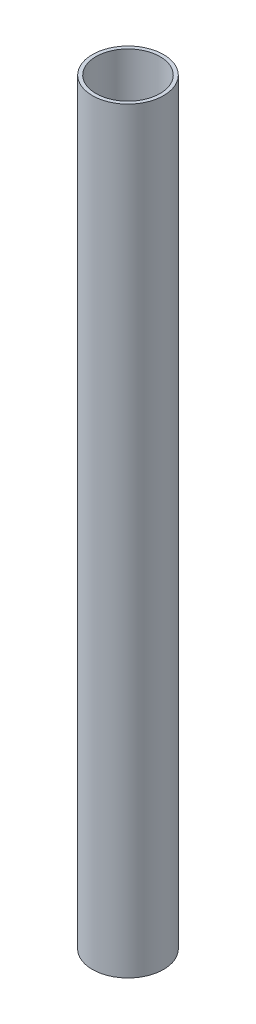
from build123d import *

# Parameters (mm, degrees)
SKETCH1_R           = 10
SKETCH1_R_2         = 9
BOSS_EXTRUDE1_DEPTH = 212.6


with BuildPart() as part:
    # Sketch1 → Boss-Extrude1 (new body)
    with BuildSketch(Plane(origin=(0, 0, 0), x_dir=(1, 0, 0), z_dir=(0, 1, 0))):
        Circle(SKETCH1_R)
        Circle(SKETCH1_R_2, mode=Mode.SUBTRACT)
    extrude(amount=BOSS_EXTRUDE1_DEPTH)


solid = part.part
